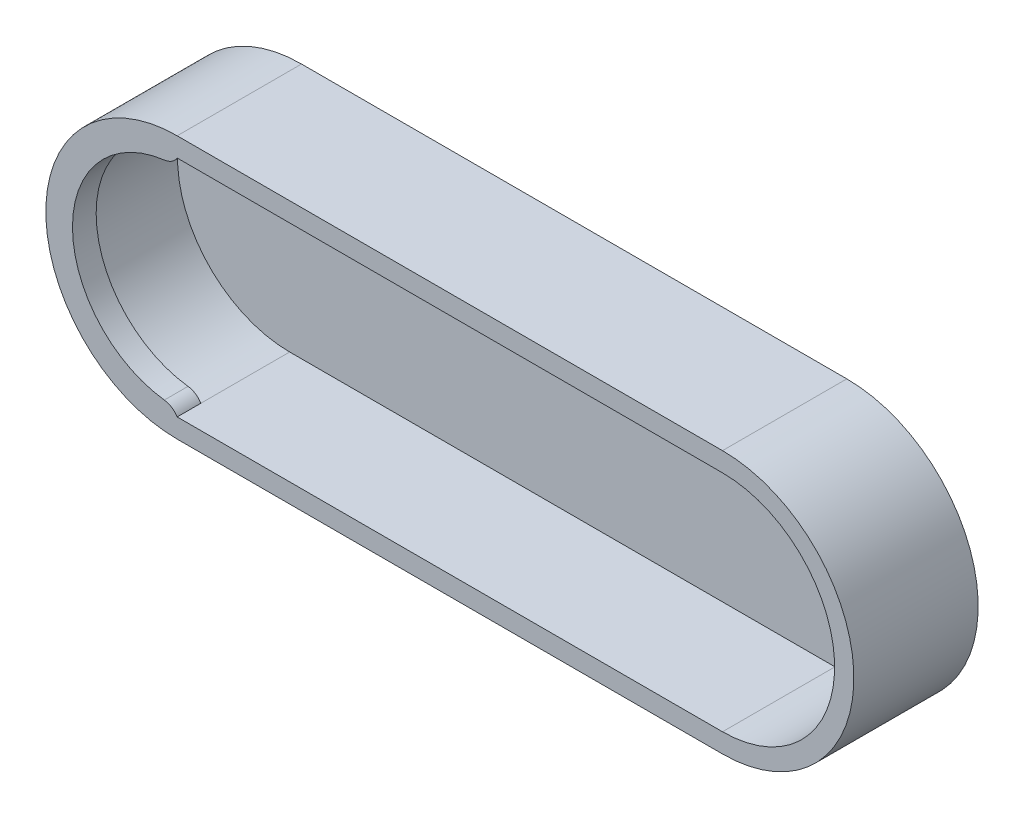
from build123d import *

# Parameters (mm, degrees)
BOSS_EXTRUDE3_DEPTH = 21
BOSS_EXTRUDE4_DEPTH = 2
BOSS_EXTRUDE7_START = -4
BOSS_EXTRUDE7_DEPTH = 4
FILLET3_R           = 3


with BuildPart() as part:
    # Sketch1 → Boss-Extrude3 (new body)
    with BuildSketch(Plane.XY):
        with BuildLine():
            Line((-46.06, 22.19), (46.06, 22.19))
            ThreePointArc((46.06, 22.19), (68.25, 0), (46.06, -22.19))
            Line((46.06, -22.19), (-46.06, -22.19))
            ThreePointArc((-46.06, -22.19), (-68.25, 0), (-46.06, 22.19))
        make_face()
        with BuildLine():
            Line((-46.06, 18.94), (46.06, 18.94))
            ThreePointArc((46.06, 18.94), (65, 0), (46.06, -18.94))
            Line((46.06, -18.94), (-46.06, -18.94))
            ThreePointArc((-46.06, -18.94), (-65, 0), (-46.06, 18.94))
        make_face(mode=Mode.SUBTRACT)
    extrude(amount=BOSS_EXTRUDE3_DEPTH)

    # Sketch5 → Boss-Extrude7 (add)
    with BuildSketch(Plane.XY.offset(21).offset(BOSS_EXTRUDE7_START)):
        with BuildLine():
            Line((-46.06, 17.69), (-46.06, 18.94))
            ThreePointArc((-46.06, 18.94), (-65, 0), (-46.06, -18.94))
            Line((-46.06, -18.94), (-46.06, -17.69))
            ThreePointArc((-46.06, -17.69), (-63.75, 0), (-46.06, 17.69))
        make_face()
    extrude(amount=BOSS_EXTRUDE7_DEPTH)

    # Fillet3
    # the kernel refuses this fillet: 3 mm, written as the material it takes off along each edge
    with BuildSketch(Plane(origin=(-46.06, 17.69, 11.556234358), x_dir=(-1.8644641386323197e-12, 1.0, 0), z_dir=(0, 0, 1))) as fillet3_piece_1:
        with BuildLine():
            CenterArc((2.843255016, 2.541955636), FILLET3_R, 187.057140648, 50.864065739)
            Line((-0.13401734, 2.173378212), (-0.193562787, 2.166006663))
            ThreePointArc((-0.193562787, 2.166006663), (-0.093422377, 1.085060353), (-0.06, 0))
            Line((-0.06, 0), (0, -0.06))
            ThreePointArc((0, -0.06), (0.625, -0.06), (1.2181349, -0.050839113))
            Line((1.2181349, -0.050839113), (1.25, 0))
        make_face()
    extrude(amount=14.887531284, mode=Mode.SUBTRACT)
    with BuildSketch(Plane(origin=(-46.06, -17.69, 11.556234358), x_dir=(-1.8474111129741445e-12, -1.0, 0), z_dir=(0, 0, 1))) as fillet3_piece_2:
        with BuildLine():
            CenterArc((2.843255016, -2.541955636), FILLET3_R, 122.078793613, 50.864065739)
            Line((-0.13401734, -2.173378212), (-0.193562787, -2.166006663))
            ThreePointArc((-0.193562787, -2.166006663), (-0.093422377, -1.085060353), (-0.06, 0))
            Line((-0.06, 0), (0, 0.06))
            ThreePointArc((0, 0.06), (0.625, 0.06), (1.2181349, 0.050839113))
            Line((1.2181349, 0.050839113), (1.25, 0))
        make_face()
    extrude(amount=14.887531284, mode=Mode.SUBTRACT)


with BuildPart() as body_2:
    # Sketch3 → Boss-Extrude4 (new body)
    with BuildSketch(Plane(origin=(0, 0, 0), x_dir=(-1, 0, 0), z_dir=(0, 0, -1))):
        with BuildLine():
            Line((-46.06, 18.94), (46.06, 18.94))
            ThreePointArc((46.06, 18.94), (65, 0), (46.06, -18.94))
            Line((46.06, -18.94), (-46.06, -18.94))
            ThreePointArc((-46.06, -18.94), (-65, 0), (-46.06, 18.94))
        make_face()
    extrude(amount=-BOSS_EXTRUDE4_DEPTH)


solid = Compound([part.part, body_2.part])
